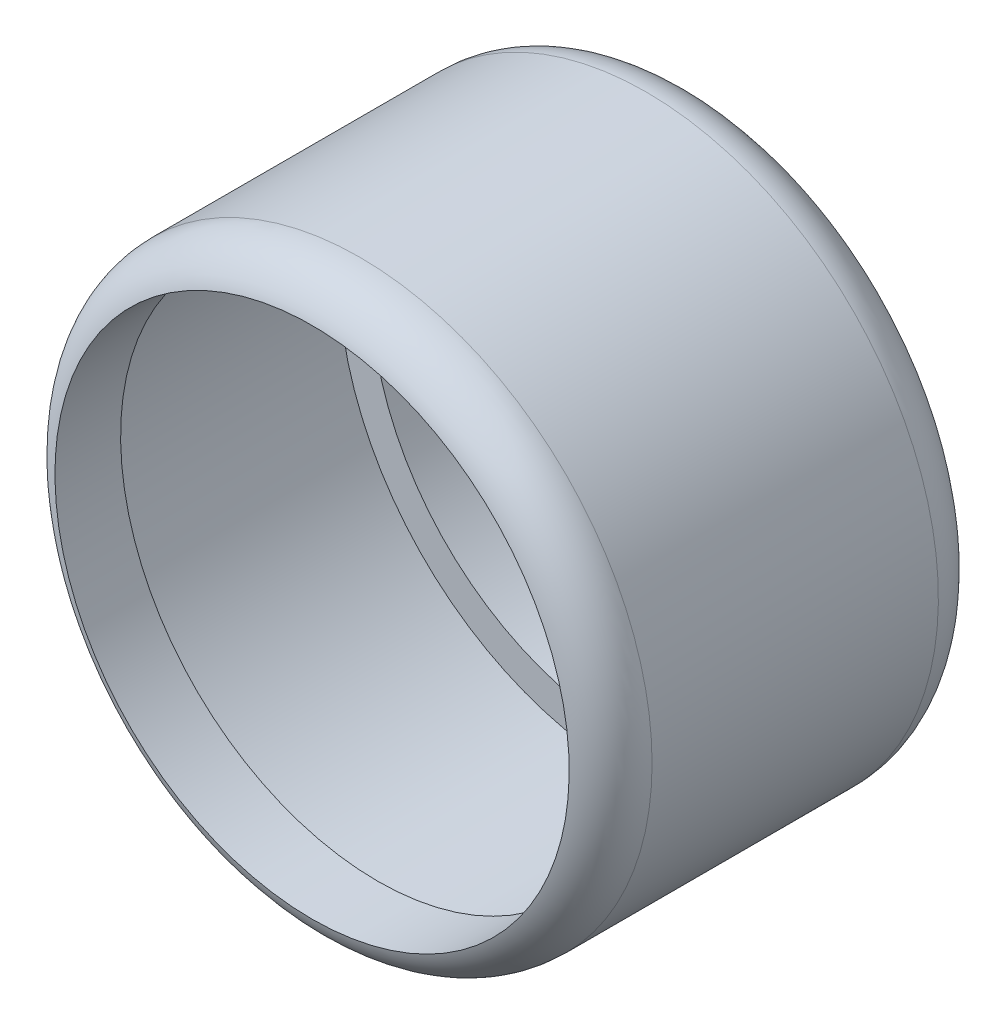
from build123d import *

# Parameters (mm, degrees)
SKETCH1_R             = 29.15
SKETCH1_R_2           = 28.9
BOSS_EXTRUDE1_DEPTH   = 25
SKETCH2_R             = 29.15
SKETCH2_R_2           = 25.65
BOSS_EXTRUDE2_DEPTH   = 6.55
BOSS_EXTRUDE3_START   = 6.55
SKETCH3_R             = 29.15
SKETCH3_R_2           = 25.65
BOSS_EXTRUDE3_DEPTH   = 6.55
SKETCH4_R             = 25.4
SKETCH4_R_2           = 24.9
BOSS_EXTRUDE4_DEPTH   = 1
FILLET1_R             = 5
BODY_MOVE_COPY4_ANGLE = 90


with BuildPart() as part:
    # Sketch1 → Boss-Extrude1 (new body)
    with BuildSketch(Plane(origin=(0, 0, 0), x_dir=(1, 0, 0), z_dir=(0, 1, 0))):
        with Locations(Location((0, 0, 0), (0, 0, 270))):
            Circle(SKETCH1_R)
        with Locations(Location((0, 0, 0), (0, 0, 270))):
            Circle(SKETCH1_R_2, mode=Mode.SUBTRACT)
    extrude(amount=BOSS_EXTRUDE1_DEPTH)

    # Sketch2 → Boss-Extrude2 (add)
    with BuildSketch(Plane(origin=(0, 25, 0), x_dir=(1, 0, 0), z_dir=(0, 1, 0))):
        with Locations(Location((0, 0, 0), (0, 0, 270))):
            Circle(SKETCH2_R)
        with Locations(Location((0, 0, 0), (0, 0, 270))):
            Circle(SKETCH2_R_2, mode=Mode.SUBTRACT)
    extrude(amount=BOSS_EXTRUDE2_DEPTH)

    # Sketch3 → Boss-Extrude3 (add)
    with BuildSketch(Plane.XZ.offset(BOSS_EXTRUDE3_START)):
        with Locations(Location((0, 0, 0), (0, 0, 270))):
            Circle(SKETCH3_R)
        with Locations(Location((0, 0, 0), (0, 0, 90))):
            Circle(SKETCH3_R_2, mode=Mode.SUBTRACT)
    extrude(amount=-BOSS_EXTRUDE3_DEPTH)

    # Fillet1
    # the kernel refuses this fillet: 5 mm, written as the material it takes off along each edge
    with BuildSketch(Plane(origin=(0, -6.55, 0), x_dir=(0, 0, -1), z_dir=(-1, 0, 0))) as fillet1_piece_1:
        with BuildLine():
            CenterArc((24.15, -4.769696007), FILLET1_R, 0, 72.542396876)
            Line((25.65, 0), (25.68, 0.09539392))
            ThreePointArc((25.68, 0.09539392), (27.4, 0.1), (29.15, 0.1))
            Line((29.15, 0.1), (29.25, 0))
            Line((29.25, 0), (29.25, -4.769696007))
            Line((29.25, -4.769696007), (29.15, -4.769696007))
        make_face()
    revolve(axis=Axis((0, -6.55, 0), (0, -1, 0)), mode=Mode.SUBTRACT)
    with BuildSketch(Plane(origin=(0, 31.55, 0), x_dir=(0, 0, 1), z_dir=(-1, 0, 0))) as fillet1_piece_2:
        with BuildLine():
            CenterArc((24.15, -4.769696007), FILLET1_R, 360, 72.542396876)
            Line((25.65, 0), (25.68, 0.09539392))
            ThreePointArc((25.68, 0.09539392), (27.4, 0.1), (29.15, 0.1))
            Line((29.15, 0.1), (29.25, 0))
            Line((29.25, 0), (29.25, -4.769696007))
            Line((29.25, -4.769696007), (29.15, -4.769696007))
        make_face()
    revolve(axis=Axis((0, 31.55, 0), (0, 1, 0)), mode=Mode.SUBTRACT)


with BuildPart() as body_2:
    # Sketch4 → Boss-Extrude4 (new body)
    with BuildSketch(Plane.XZ.offset(6.55)):
        with Locations(Location((0, 0, 0), (0, 0, 270))):
            Circle(SKETCH4_R)
        with Locations(Location((0, 0, 0), (0, 0, 270))):
            Circle(SKETCH4_R_2, mode=Mode.SUBTRACT)
    extrude(amount=-BOSS_EXTRUDE4_DEPTH)


with BuildPart() as part_1:
    # Body-Move/Copy4: moved
    add(part.part.rotate(Axis((0, 3.225, 0), (1, 0, 0)), BODY_MOVE_COPY4_ANGLE))


with BuildPart() as body_2_1:
    # Body-Move/Copy4: moved
    add(body_2.part.rotate(Axis((0, 3.225, 0), (1, 0, 0)), BODY_MOVE_COPY4_ANGLE))


solid = Compound([part_1.part, body_2_1.part])
